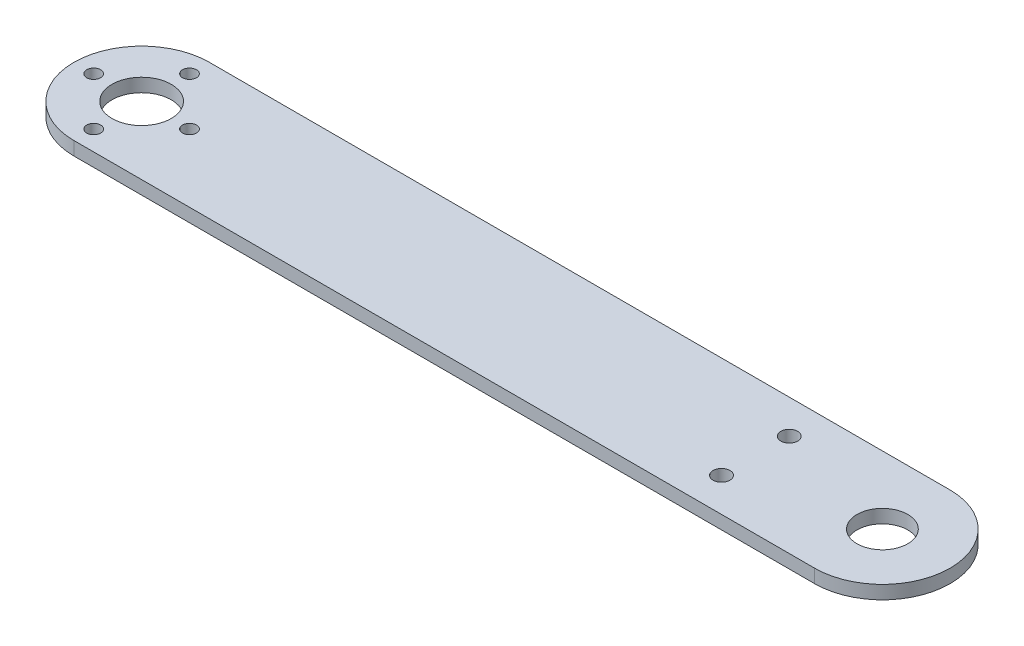
from build123d import *

# Parameters (mm, degrees)
SKETCH1_R           = 7
SKETCH1_R_2         = 6
BOSS_EXTRUDE1_DEPTH = 3.175
SKETCH2_R           = 1.65
CUT_EXTRUDE1_DEPTH  = 10
SKETCH3_R           = 2
CUT_EXTRUDE2_DEPTH  = 10


with BuildPart() as part:
    # Sketch1 → Boss-Extrude1 (new body)
    with BuildSketch(Plane(origin=(0, 0, 0), x_dir=(1, 0, 0), z_dir=(0, 1, 0))):
        with BuildLine():
            Line((175, 32), (0, 32))
            ThreePointArc((0, 32), (-16, 16), (0, 0))
            Line((0, 0), (175, 0))
            ThreePointArc((175, 0), (191, 16), (175, 32))
        make_face()
        with Locations((0, 16)):
            Circle(SKETCH1_R, mode=Mode.SUBTRACT)
        with Locations((175, 16)):
            Circle(SKETCH1_R_2, mode=Mode.SUBTRACT)
    extrude(amount=BOSS_EXTRUDE1_DEPTH)

    # Sketch2 → Cut-Extrude1 (cut)
    with BuildSketch(Plane(origin=(0, 3.175, 0), x_dir=(1, 0, 0), z_dir=(0, 1, 0))):
        with Locations((-11.313708499, 16)):
            Circle(SKETCH2_R)
        with Locations((11.313708499, 16)):
            Circle(SKETCH2_R)
        with Locations((0, 27.313708499)):
            Circle(SKETCH2_R)
        with Locations((0, 4.686291501)):
            Circle(SKETCH2_R)
    extrude(amount=-CUT_EXTRUDE1_DEPTH, mode=Mode.SUBTRACT)

    # Sketch3 → Cut-Extrude2 (cut)
    with BuildSketch(Plane(origin=(0, 3.175, 0), x_dir=(1, 0, 0), z_dir=(0, 1, 0))):
        with Locations((145, 24)):
            Circle(SKETCH3_R)
        with Locations((145, 8)):
            Circle(SKETCH3_R)
    extrude(amount=-CUT_EXTRUDE2_DEPTH, mode=Mode.SUBTRACT)


solid = part.part
